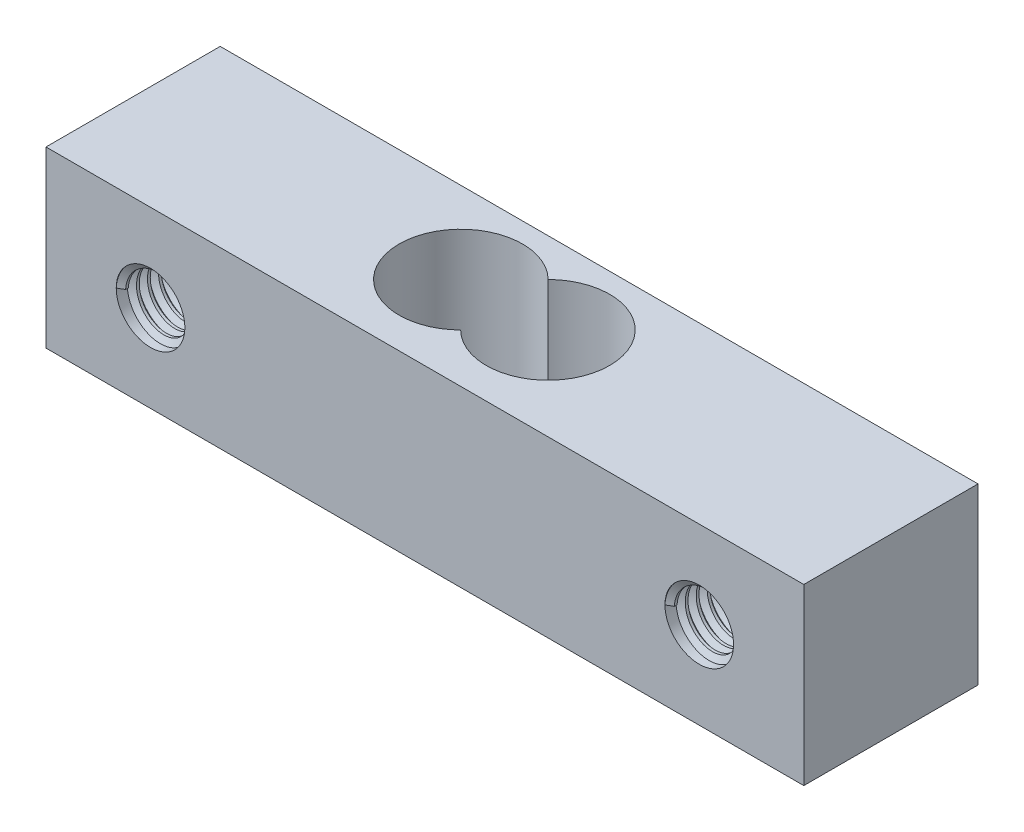
from build123d import *

# Parameters (mm, degrees)
SKETCH1_W             = 55.245
SKETCH1_H             = 12.7
BOSS_EXTRUDE1_DEPTH   = 12.7
F_5_0MM_DOWEL_HOLE1_D = 5
THREAD1_PITCH         = 0.8
THREAD2_PITCH         = 0.8
F_8_0MM_DOWEL_HOLE2_D = 9


with BuildPart() as part:
    # Sketch1 → Boss-Extrude1 (new body)
    with BuildSketch(Plane.XY):
        with Locations((27.6225, 6.35)):
            Rectangle(SKETCH1_W, SKETCH1_H)
    extrude(amount=BOSS_EXTRUDE1_DEPTH)

    # Ø5.0mm Dowel Hole1 (through all)
    with Locations(Plane.XY.offset(12.7)):
        with Locations((7.62, 6.35), (47.625, 6.35)):
            Hole(F_5_0MM_DOWEL_HOLE1_D / 2)

    # Thread1: the profile of Thread Profile2 profile screwed along a right-hand helix of 15.081501 turns, 8 arcs to a turn; built about Z, then put on its axis
    thread1_z = Axis((0, 0, 0), (0, 0, 1))
    thread1_corners = [(2.5003, 0, -0.000173205), (2.5003, 0, 0.700173203), (2.0669873, 0, 0.449999999), (2.0669873, 0, 0.249999999)]
    with BuildLine(mode=Mode.PRIVATE) as thread1_profile:
        Line(thread1_corners[0], thread1_corners[1])
        Line(thread1_corners[1], thread1_corners[2])
        Line(thread1_corners[2], thread1_corners[3])
        Line(thread1_corners[3], thread1_corners[0])
    thread1_cap = Face(thread1_profile.wire())
    thread1_turn_angles = [0, 22.5, 45, 67.5, 90, 112.5, 135, 157.5, 180, 202.5, 225, 247.5, 270, 292.5, 315, 337.5, 360]
    thread1_turn_weights = [1, 0.9238795325112867, 1, 0.9238795325112867, 1, 0.9238795325112867, 1, 0.9238795325112867, 1, 0.9238795325112867, 1, 0.9238795325112867, 1, 0.9238795325112867, 1, 0.9238795325112867, 1]
    thread1_turn_rails = [Edge.make_bspline([Vector(p[0], p[1], 0).rotate(thread1_z, thread1_turn_angles[k]) / thread1_turn_weights[k] + Vector(0, 0, p[2] + THREAD1_PITCH * thread1_turn_angles[k] / 360) for k in range(17)], [0, 0, 0, 1, 1, 2, 2, 3, 3, 4, 4, 5, 5, 6, 6, 7, 7, 8, 8, 8], 2, thread1_turn_weights) for p in thread1_corners]
    thread1_turn_sides = [Face.make_surface_from_curves(thread1_turn_rails[p[0]], thread1_turn_rails[p[1]]) for p in [(0, 1), (1, 2), (2, 3), (3, 0)]]
    thread1_last_angles = [5400, 5414.6701485, 5429.340297]
    thread1_last_weights = [1, 0.9673998311440346, 1]
    thread1_last_rails = [Edge.make_bspline([Vector(p[0], p[1], 0).rotate(thread1_z, thread1_last_angles[k]) / thread1_last_weights[k] + Vector(0, 0, p[2] + THREAD1_PITCH * thread1_last_angles[k] / 360) for k in range(3)], [0, 0, 0, 1, 1, 1], 2, thread1_last_weights) for p in thread1_corners]
    thread1_last_sides = [Face.make_surface_from_curves(thread1_last_rails[p[0]], thread1_last_rails[p[1]]) for p in [(0, 1), (1, 2), (2, 3), (3, 0)]]
    thread1 = Plane(origin=(7.62, 6.35, 12.7), x_dir=(-1, 0, 0), z_dir=(0, 0, -1)) * Solid(Shell([*[p.moved(Location((0, 0, THREAD1_PITCH * i))) for i in range(15) for p in thread1_turn_sides], *thread1_last_sides, thread1_cap, thread1_cap.rotate(thread1_z, 5429.340297).moved(Location((0, 0, THREAD1_PITCH * 5429.340297 / 360)))]))
    add(thread1)

    # Thread2: the profile of Thread Profile3 profile screwed along a right-hand helix of 15.08125 turns, 8 arcs to a turn; built about Z, then put on its axis
    thread2_z = Axis((0, 0, 0), (0, 0, 1))
    thread2_corners = [(2.5003, 0, -0.000173205), (2.5003, 0, 0.700173203), (2.0669873, 0, 0.449999999), (2.0669873, 0, 0.249999999)]
    with BuildLine(mode=Mode.PRIVATE) as thread2_profile:
        Line(thread2_corners[0], thread2_corners[1])
        Line(thread2_corners[1], thread2_corners[2])
        Line(thread2_corners[2], thread2_corners[3])
        Line(thread2_corners[3], thread2_corners[0])
    thread2_cap = Face(thread2_profile.wire())
    thread2_turn_angles = [0, 22.5, 45, 67.5, 90, 112.5, 135, 157.5, 180, 202.5, 225, 247.5, 270, 292.5, 315, 337.5, 360]
    thread2_turn_weights = [1, 0.9238795325112867, 1, 0.9238795325112867, 1, 0.9238795325112867, 1, 0.9238795325112867, 1, 0.9238795325112867, 1, 0.9238795325112867, 1, 0.9238795325112867, 1, 0.9238795325112867, 1]
    thread2_turn_rails = [Edge.make_bspline([Vector(p[0], p[1], 0).rotate(thread2_z, thread2_turn_angles[k]) / thread2_turn_weights[k] + Vector(0, 0, p[2] + THREAD2_PITCH * thread2_turn_angles[k] / 360) for k in range(17)], [0, 0, 0, 1, 1, 2, 2, 3, 3, 4, 4, 5, 5, 6, 6, 7, 7, 8, 8, 8], 2, thread2_turn_weights) for p in thread2_corners]
    thread2_turn_sides = [Face.make_surface_from_curves(thread2_turn_rails[p[0]], thread2_turn_rails[p[1]]) for p in [(0, 1), (1, 2), (2, 3), (3, 0)]]
    thread2_last_angles = [5400, 5414.625, 5429.25]
    thread2_last_weights = [1, 0.9675990923602618, 1]
    thread2_last_rails = [Edge.make_bspline([Vector(p[0], p[1], 0).rotate(thread2_z, thread2_last_angles[k]) / thread2_last_weights[k] + Vector(0, 0, p[2] + THREAD2_PITCH * thread2_last_angles[k] / 360) for k in range(3)], [0, 0, 0, 1, 1, 1], 2, thread2_last_weights) for p in thread2_corners]
    thread2_last_sides = [Face.make_surface_from_curves(thread2_last_rails[p[0]], thread2_last_rails[p[1]]) for p in [(0, 1), (1, 2), (2, 3), (3, 0)]]
    thread2 = Plane(origin=(47.625, 6.35, 12.7), x_dir=(-1, 0, 0), z_dir=(0, 0, -1)) * Solid(Shell([*[p.moved(Location((0, 0, THREAD2_PITCH * i))) for i in range(15) for p in thread2_turn_sides], *thread2_last_sides, thread2_cap, thread2_cap.rotate(thread2_z, 5429.25).moved(Location((0, 0, THREAD2_PITCH * 5429.25 / 360)))]))
    add(thread2)

    # Ø8.0mm Dowel Hole2 (through all)
    with Locations(Plane(origin=(0, 12.7, 0), x_dir=(1, 0, 0), z_dir=(0, 1, 0))):
        with Locations((23.495, -5.952951387), (29.845, -5.952951387)):
            Hole(F_8_0MM_DOWEL_HOLE2_D / 2)


solid = part.part
